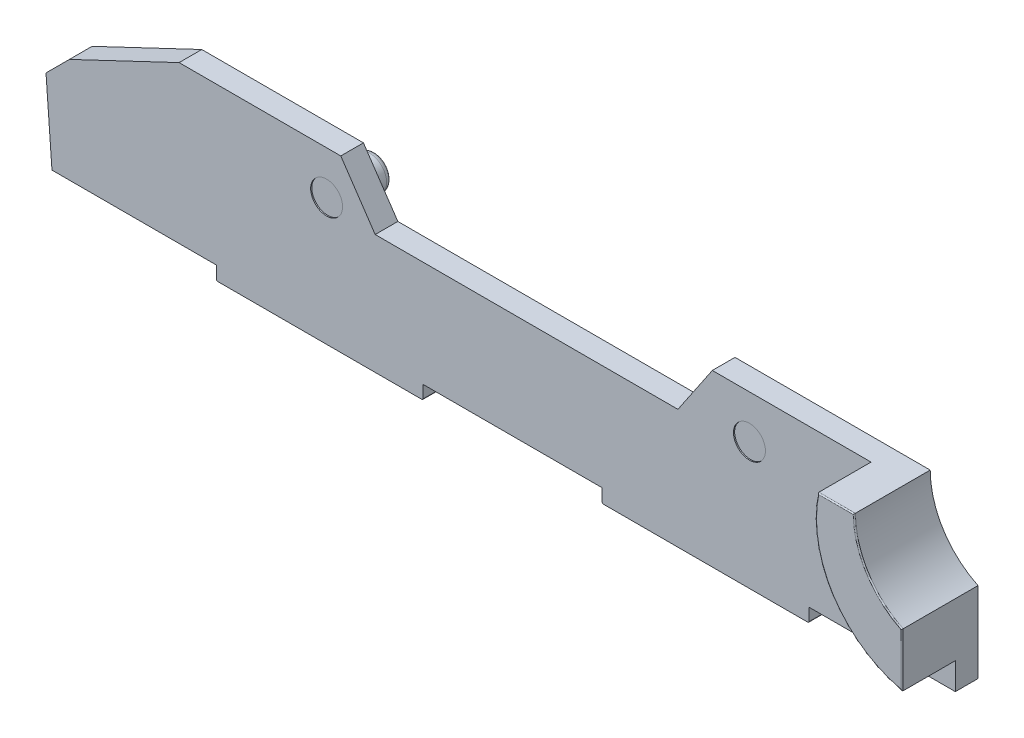
from build123d import *

# Parameters (mm, degrees)
BOSS_EXTRUDE1_DEPTH = 2
SKETCH2_W           = 18.25
SKETCH2_H           = 1.2
BOSS_EXTRUDE2_DEPTH = 1.2
SKETCH3_W           = 18.25
SKETCH3_H           = 1.2
BOSS_EXTRUDE3_DEPTH = 1.2
FILLET1_R           = 0.1
FILLET2_R           = 0.1
FILLET3_R           = 0.1
FILLET4_R           = 0.1
SKETCH4_R           = 1.41
CUT_EXTRUDE1_DEPTH  = 0.1
BOSS_EXTRUDE4_DEPTH = 4.7
FILLET5_R           = 0.1
SHELL1_START        = 0.710139039
SHELL1_DEPTH        = 77.819860961
SHELL1_START_2      = 1.115016449
SHELL1_2_OUTLINE_W  = 4.49
SHELL1_2_OUTLINE_H  = 0.8
SHELL1_2_DEPTH      = 26.773626454
SHELL1_START_3      = 55.883029025
SHELL1_3_OUTLINE_W  = 4.49
SHELL1_3_OUTLINE_H  = 0.8
SHELL1_3_DEPTH      = 22.646970975
SHELL1_START_4      = 0.8
SHELL1_4_DEPTH      = 4.7
SHELL1_5_DEPTH      = 0.8
SHELL1_START_5      = 0.7
SHELL1_6_OUTLINE_R  = 2.61
SHELL1_6_DEPTH      = 0.1
BOSS_EXTRUDE5_DEPTH = 0.5
SKETCH7_R           = 1.5
BOSS_EXTRUDE6_DEPTH = 3
FILLET6_R           = 0.5
SKETCH8_R           = 0.5
CUT_EXTRUDE2_DEPTH  = 3
SKETCH9_R           = 1.5
BOSS_EXTRUDE7_DEPTH = 3
FILLET7_R           = 0.5
SKETCH10_R          = 0.5
CUT_EXTRUDE3_DEPTH  = 3
FILLET10_R          = 2
FILLET11_R          = 2


with BuildPart() as part:
    # Sketch1 → Boss-Extrude1 (new body)
    with BuildSketch(Plane.XY):
        with BuildLine():
            Line((0, 0), (79.73, 0))
            Line((79.73, 0), (79.73, 7.11))
            ThreePointArc((79.73, 7.11), (76.653638062, 9.862863384), (75.511671928, 13.83))
            Line((75.511671928, 13.83), (58.281671928, 13.83))
            Line((58.281671928, 13.83), (55.245835964, 9.34))
            Line((55.245835964, 9.34), (28.525835964, 9.34))
            Line((28.525835964, 9.34), (25.49, 13.83))
            Line((25.49, 13.83), (11.22, 13.83))
            Line((11.22, 13.83), (1.537833793, 9.231903563))
            Line((1.537833793, 9.231903563), (-0.526918008, 7.167151762))
            Line((-0.526918008, 7.167151762), (0, 0))
        make_face()
    extrude(amount=BOSS_EXTRUDE1_DEPTH)

    # Sketch2 → Boss-Extrude2 (add)
    with BuildSketch(Plane.XZ):
        with Locations((23.625, 1.4)):
            Rectangle(SKETCH2_W, SKETCH2_H)
    extrude(amount=BOSS_EXTRUDE2_DEPTH)

    # Sketch3 → Boss-Extrude3 (add)
    with BuildSketch(Plane.XZ):
        with Locations((57.685, 1.4)):
            Rectangle(SKETCH3_W, SKETCH3_H)
    extrude(amount=BOSS_EXTRUDE3_DEPTH)

    # Fillet1
    fillet1_edges = [part.edges().sort_by_distance(p)[0] for p in [
        (66.81, -1.2, 1.4),
    ]]
    fillet(fillet1_edges, radius=FILLET1_R)

    # Fillet2
    fillet2_edges = [part.edges().sort_by_distance(p)[0] for p in [
        (48.56, -1.2, 1.4),
    ]]
    fillet(fillet2_edges, radius=FILLET2_R)

    # Fillet3
    fillet3_edges = [part.edges().sort_by_distance(p)[0] for p in [
        (32.75, -1.2, 1.4),
    ]]
    fillet(fillet3_edges, radius=FILLET3_R)

    # Fillet4
    fillet4_edges = [part.edges().sort_by_distance(p)[0] for p in [
        (14.5, -1.2, 1.4),
    ]]
    fillet(fillet4_edges, radius=FILLET4_R)

    # Sketch4 → Cut-Extrude1 (cut)
    with BuildSketch(Plane.XY.offset(2)):
        with Locations((24.239473279, 10.02)):
            Circle(SKETCH4_R)
        with Locations((61.560171923, 10.02)):
            Circle(SKETCH4_R)
    extrude(amount=-CUT_EXTRUDE1_DEPTH, mode=Mode.SUBTRACT)

    # Sketch5 → Boss-Extrude4 (add)
    with BuildSketch(Plane.XY.offset(2)):
        with BuildLine():
            Line((75.511671928, 13.83), (72.291671928, 13.83))
            ThreePointArc((72.291671928, 13.83), (73.637392252, 6.559471816), (79.73, 2.37))
            Line((79.73, 2.37), (79.73, 7.11))
            ThreePointArc((79.73, 7.11), (76.653638062, 9.862863384), (75.511671928, 13.83))
        make_face()
    extrude(amount=BOSS_EXTRUDE4_DEPTH)

    # Fillet5
    fillet5_edges = [part.edges().sort_by_distance(p)[0] for p in [
        (76.653638062, 9.862863384, 6.7),
        (73.901671928, 13.83, 6.7),
        (73.637392252, 6.559471816, 6.7),
        (79.73, 4.74, 6.7),
    ]]
    fillet(fillet5_edges, radius=FILLET5_R)

    # Shell1: read off the stored shape, not the designer's step
    # Shell1 outline → Shell1 (cut)
    with BuildSketch(Plane.YZ.offset(SHELL1_START)):
        Polygon((8.14, 0.7), (8.14, 0.8), (1.2, 0.8), (1.2, 0), (8.14, 0), align=None)
    extrude(amount=SHELL1_DEPTH, mode=Mode.SUBTRACT)

    # Shell1 2 outline → Shell1 2 (cut)
    with BuildSketch(Plane.YZ.offset(SHELL1_START_2)):
        with Locations((10.385, 0.4)):
            Rectangle(SHELL1_2_OUTLINE_W, SHELL1_2_OUTLINE_H)
    extrude(amount=SHELL1_2_DEPTH, mode=Mode.SUBTRACT)

    # Shell1 3 outline → Shell1 3 (cut)
    with BuildSketch(Plane.YZ.offset(SHELL1_START_3)):
        with Locations((10.385, 0.4)):
            Rectangle(SHELL1_3_OUTLINE_W, SHELL1_3_OUTLINE_H)
    extrude(amount=SHELL1_3_DEPTH, mode=Mode.SUBTRACT)

    # Shell1 4 outline → Shell1 4 (cut)
    with BuildSketch(Plane.XY.offset(SHELL1_START_4)):
        with BuildLine():
            Line((78.53, 3.991336383), (78.53, 6.394787335))
            ThreePointArc((78.53, 6.394787335), (75.75468216, 9.042947573), (74.395198194, 12.63))
            Line((74.395198194, 12.63), (73.31902509, 12.63))
            ThreePointArc((73.31902509, 12.63), (74.496096812, 7.449025827), (78.53, 3.991336383))
        make_face()
    extrude(amount=SHELL1_4_DEPTH, mode=Mode.SUBTRACT)

    # Shell1 5 outline → Shell1 5 (add)
    with BuildSketch(Plane.XY):
        with BuildLine():
            Line((78.53, 6.394787335), (78.53, 7.835498111))
            ThreePointArc((78.53, 7.835498111), (76.601274587, 9.947529982), (75.608795397, 12.63))
            Line((75.608795397, 12.63), (74.395198194, 12.63))
            ThreePointArc((74.395198194, 12.63), (75.75468216, 9.042947573), (78.53, 6.394787335))
        make_face()
        Polygon((0.710139039, 1.2), (1.115016449, 1.2), (0.710139039, 6.707152534), align=None)
        Polygon((55.883029025, 8.14), (58.918864989, 12.63), (57.47031265, 12.63), (55.883029025, 10.282408245), align=None)
        Polygon((0.710139039, 8.14), (0.710139039, 6.707152534), (2.239820192, 8.236833687), (11.490467063, 12.63), (8.693171864, 12.63), (1.537833793, 9.231903563), (1.115016449, 8.809086219), (1.115016449, 8.14), align=None)
        Polygon((24.852806939, 12.63), (27.888642903, 8.14), (27.888642903, 10.282408245), (26.301359278, 12.63), align=None)
    extrude(amount=SHELL1_5_DEPTH)

    # Shell1 6 outline → Shell1 6 (add)
    with BuildSketch(Plane.XY.offset(SHELL1_START_5)):
        with Locations((61.560171923, 10.02)):
            Circle(SHELL1_6_OUTLINE_R)
        with BuildLine():
            ThreePointArc((24.912484692, 12.541736631), (22.077314607, 8.558093751), (26.830410206, 9.705125674))
            Line((26.830410206, 9.705125674), (24.912484692, 12.541736631))
        make_face()
    extrude(amount=SHELL1_6_DEPTH)

    # Sketch6 → Boss-Extrude5 (add)
    with BuildSketch(Plane(origin=(0, 0, 0.8), x_dir=(-1, 0, 0), z_dir=(0, 0, -1))):
        Polygon((-74.121905242, 8.14), (-2.142986505, 8.14), (-0.942986505, 6.94), (-74.828664694, 6.94), align=None)
    extrude(amount=BOSS_EXTRUDE5_DEPTH)

    # Sketch7 → Boss-Extrude6 (add)
    with BuildSketch(Plane(origin=(0, 0, 0.7), x_dir=(-1, 0, 0), z_dir=(0, 0, -1))):
        with Locations(Location((-61.560171923, 10.02, 0), (0, 0, 180))):
            Circle(SKETCH7_R)
    extrude(amount=BOSS_EXTRUDE6_DEPTH)

    # Fillet6
    fillet6_edges = [part.edges().sort_by_distance(p)[0] for p in [
        (60.060171923, 10.02, -2.3),
    ]]
    fillet(fillet6_edges, radius=FILLET6_R)

    # Sketch8 → Cut-Extrude2 (cut)
    with BuildSketch(Plane(origin=(0, 0, -2.3), x_dir=(-1, 0, 0), z_dir=(0, 0, -1))):
        with Locations((-61.560171923, 10.02)):
            Circle(SKETCH8_R)
    extrude(amount=-CUT_EXTRUDE2_DEPTH, mode=Mode.SUBTRACT)

    # Sketch9 → Boss-Extrude7 (add)
    with BuildSketch(Plane(origin=(0, 0, 0.7), x_dir=(-1, 0, 0), z_dir=(0, 0, -1))):
        with Locations(Location((-24.239473279, 10.02, 0), (0, 0, 180))):
            Circle(SKETCH9_R)
    extrude(amount=BOSS_EXTRUDE7_DEPTH)

    # Fillet7
    fillet7_edges = [part.edges().sort_by_distance(p)[0] for p in [
        (22.739473279, 10.02, -2.3),
    ]]
    fillet(fillet7_edges, radius=FILLET7_R)

    # Sketch10 → Cut-Extrude3 (cut)
    with BuildSketch(Plane(origin=(0, 0, -2.3), x_dir=(-1, 0, 0), z_dir=(0, 0, -1))):
        with Locations((-24.239473279, 10.02)):
            Circle(SKETCH10_R)
    extrude(amount=-CUT_EXTRUDE3_DEPTH, mode=Mode.SUBTRACT)

    # Fillet10
    # the kernel refuses this fillet: 2 mm, written as the material it takes off along each edge
    with BuildSketch(Plane(origin=(81.740835966, 11.819164038, 0.8), x_dir=(-0.7731681215232679, 0.634201116255862, 0), z_dir=(0.634201116255862, 0.7731681215232679, 0))) as fillet10_piece_1_section:
        with BuildLine():
            CenterArc((8.460753713 + FILLET10_R, FILLET10_R), FILLET10_R, 180, 90)
            Line((8.460753713, FILLET10_R), (8.460753713, 0))
            Line((8.460753713, 0), (8.460753713 + FILLET10_R, 0))
        make_face()
    fillet10_piece_1 = revolve(axis=Axis((81.740835966, 11.819164038, 0.8), (0, 0, 1)), revolution_arc=98.997926529, mode=Mode.PRIVATE)
    fillet10_piece_1 = split(fillet10_piece_1, bisect_by=Plane(origin=(81.740835966, 12.63, 0.8), z_dir=(0, -1, 0)), keep=Keep.TOP, mode=Mode.PRIVATE)
    fillet10_piece_1 = split(fillet10_piece_1, bisect_by=Plane(origin=(81.740835966, 8.14, 0.8), z_dir=(0, 1, 0)), keep=Keep.TOP, mode=Mode.PRIVATE)
    add(fillet10_piece_1, mode=Mode.SUBTRACT)

    # Fillet11
    # the kernel refuses this fillet: 2 mm, written as the material it takes off along each edge
    with BuildSketch(Plane(origin=(81.740835966, 11.819164038, 0.8), x_dir=(-0.9997199584304023, -0.023664418774073097, 0), z_dir=(-0.023664418774073097, 0.9997199584304023, 0))) as fillet11_piece_1_section:
        with BuildLine():
            CenterArc((8.460753713 + FILLET11_R, FILLET11_R), FILLET11_R, 180, 90)
            Line((8.460753713, FILLET11_R), (8.460753713, 0))
            Line((8.460753713, 0), (8.460753713 + FILLET11_R, 0))
        make_face()
    fillet11_piece_1 = revolve(axis=Axis((81.740835966, 11.819164038, 0.8), (0, 0, 1)), revolution_arc=100.202942333, mode=Mode.PRIVATE)
    fillet11_piece_1 = split(fillet11_piece_1, bisect_by=Plane(origin=(78.53, 11.819164038, 0.8), z_dir=(-1, 0, 0)), keep=Keep.TOP, mode=Mode.PRIVATE)
    fillet11_piece_1 = split(fillet11_piece_1, bisect_by=Plane(origin=(81.740835966, 6.94, 0.8), z_dir=(0, -1, 0)), keep=Keep.TOP, mode=Mode.PRIVATE)
    add(fillet11_piece_1, mode=Mode.SUBTRACT)


solid = part.part
